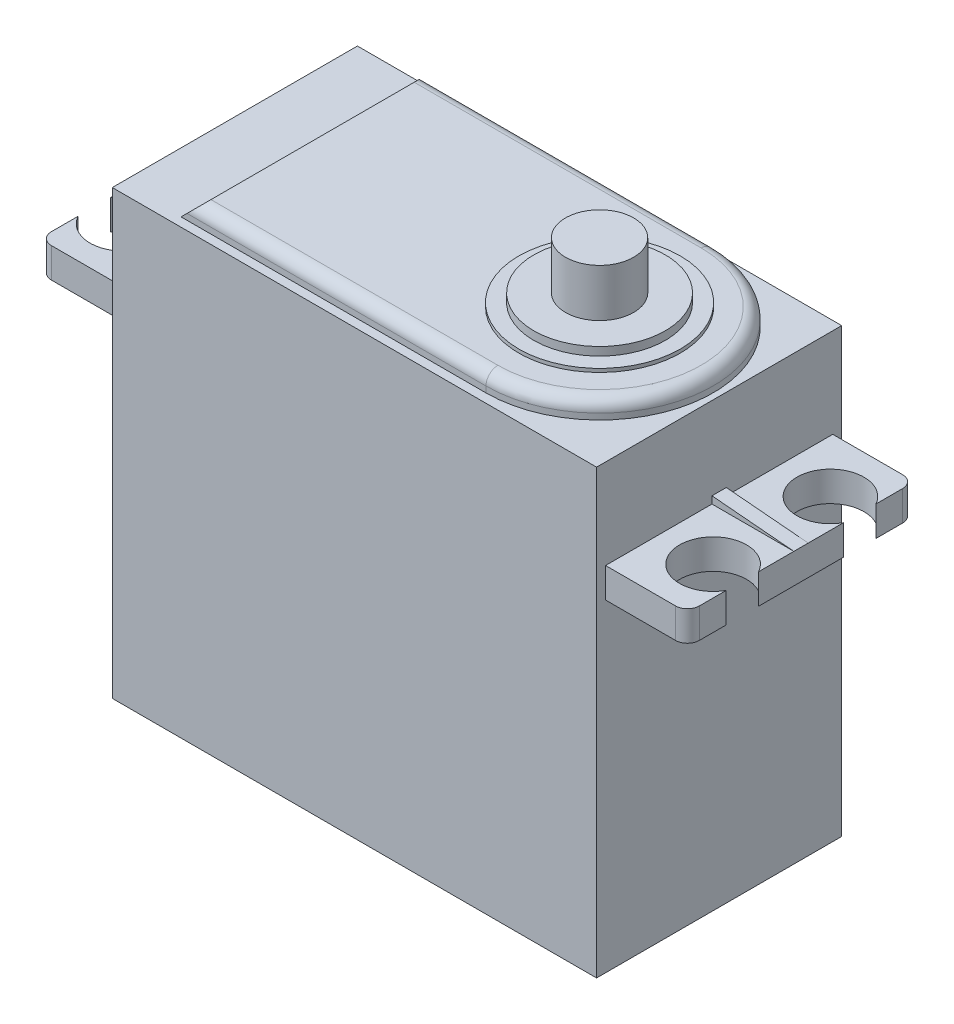
from build123d import *

# Parameters (mm, degrees)
CROQUIS1_W              = 40.5
CROQUIS1_H              = 20.5
SALIENTE_EXTRUIR1_DEPTH = 38.5
SALIENTE_EXTRUIR2_START = -11.5
SALIENTE_EXTRUIR2_DEPTH = 2.5
SALIENTE_EXTRUIR6_DEPTH = 0.6
SIMETR_A2_START         = -11.5
SIMETR_A2_COPY_1_DEPTH  = 2.5
CROQUIS4_W              = 40.5
CROQUIS4_H              = 20.5
CORTAR_EXTRUIR3_DEPTH   = 1.5
CHAFL_N1_SIZE           = 1.5
REDONDEO1_R             = 1
CROQUIS5_R              = 6.75
SALIENTE_EXTRUIR3_DEPTH = 0.3
CROQUIS6_R              = 5.5
SALIENTE_EXTRUIR4_DEPTH = 0.7
CROQUIS7_R              = 2.85
SALIENTE_EXTRUIR5_DEPTH = 4


with BuildPart() as part:
    # Croquis1 → Saliente-Extruir1 (new body)
    with BuildSketch(Plane(origin=(0, 0, 0), x_dir=(1, 0, 0), z_dir=(0, 1, 0))):
        Rectangle(CROQUIS1_W, CROQUIS1_H)
    extrude(amount=SALIENTE_EXTRUIR1_DEPTH)

    # Croquis2 → Saliente-Extruir2 (add)
    with BuildSketch(Plane(origin=(0, 38.5, 0), x_dir=(1, 0, 0), z_dir=(0, 1, 0)).offset(SALIENTE_EXTRUIR2_START)):
        with BuildLine():
            Line((-20.25, 9.5), (-26.1, 9.5))
            ThreePointArc((-26.1, 9.5), (-26.807106781, 9.207106781), (-27.1, 8.5))
            Line((-27.1, 8.5), (-27.1, 6.261088342))
            ThreePointArc((-27.1, 6.261088342), (-21.85, 4.905544171), (-27.1, 3.55))
            Line((-27.1, 3.55), (-27.1, 0))
            Line((-27.1, 0), (-20.25, 0))
            Line((-20.25, 0), (-20.25, 9.5))
        make_face()
    saliente_extruir2 = extrude(amount=SALIENTE_EXTRUIR2_DEPTH)

    # Simetría1: Saliente-Extruir2 across plane
    add(saliente_extruir2.mirror(Plane(origin=(0, 0, 0), x_dir=(1, 0, 0), z_dir=(0, 0, -1))))

    # Croquis8 → Saliente-Extruir6 (add, symmetric)
    with BuildSketch(Plane.XY):
        Polygon((-27.1, 29.5), (-20.25, 30.099297345), (-20.25, 29.5), align=None)
    saliente_extruir6 = extrude(amount=SALIENTE_EXTRUIR6_DEPTH, both=True)

    # Simetría2: Saliente-Extruir2, Saliente-Extruir6 across plane
    add(saliente_extruir2.mirror(Plane(origin=(0, 0, 0), x_dir=(0, 0, 1), z_dir=(1, 0, 0))))
    add(saliente_extruir6.mirror(Plane(origin=(0, 0, 0), x_dir=(0, 0, 1), z_dir=(1, 0, 0))))

    # Simetría2 copy 1 sketch → Simetría2 copy 1 (add)
    with BuildSketch(Plane(origin=(0, 38.5, 0), x_dir=(-1, 0, 0), z_dir=(0, 1, 0)).offset(SIMETR_A2_START)):
        with BuildLine():
            Line((-20.25, 9.5), (-26.1, 9.5))
            ThreePointArc((-26.1, 9.5), (-26.807106781, 9.207106781), (-27.1, 8.5))
            Line((-27.1, 8.5), (-27.1, 6.261088342))
            ThreePointArc((-27.1, 6.261088342), (-21.85, 4.905544171), (-27.1, 3.55))
            Line((-27.1, 3.55), (-27.1, 0))
            Line((-27.1, 0), (-20.25, 0))
            Line((-20.25, 0), (-20.25, 9.5))
        make_face()
    extrude(amount=SIMETR_A2_COPY_1_DEPTH)

    # Croquis4 → Cortar-Extruir3 (cut)
    with BuildSketch(Plane(origin=(0, 38.5, 0), x_dir=(1, 0, 0), z_dir=(0, 1, 0))):
        Rectangle(CROQUIS4_W, CROQUIS4_H)
        with BuildLine():
            Line((-15.25, 9.5), (-15.25, -9.5))
            Line((-15.25, -9.5), (10.25, -9.5))
            ThreePointArc((10.25, -9.5), (19.75, 0), (10.25, 9.5))
            Line((10.25, 9.5), (-15.25, 9.5))
        make_face(mode=Mode.SUBTRACT)
    extrude(amount=-CORTAR_EXTRUIR3_DEPTH, mode=Mode.SUBTRACT)

    # Chaflán1
    chafl_n1_edges = [part.edges().sort_by_distance(p)[0] for p in [
        (-15.25, 38.5, 0),
    ]]
    chamfer(chafl_n1_edges, length=CHAFL_N1_SIZE - 0.0001)  # a hair under: the kernel refuses the full size

    # Redondeo1
    redondeo1_edges = [part.edges().sort_by_distance(p)[0] for p in [
        (-1.75005, 38.5, -9.5),
        (19.75, 38.5, 0),
        (-1.75005, 38.5, 9.5),
    ]]
    fillet(redondeo1_edges, radius=REDONDEO1_R)

    # Croquis5 → Saliente-Extruir3 (add)
    with BuildSketch(Plane(origin=(0, 38.5, 0), x_dir=(1, 0, 0), z_dir=(0, 1, 0))):
        with Locations(Location((10.25, 0, 0), (0, 0, 90))):
            Circle(CROQUIS5_R)
    extrude(amount=SALIENTE_EXTRUIR3_DEPTH)

    # Croquis6 → Saliente-Extruir4 (add)
    with BuildSketch(Plane(origin=(0, 38.8, 0), x_dir=(1, 0, 0), z_dir=(0, 1, 0))):
        with Locations(Location((10.25, 0, 0), (0, 0, 270))):
            Circle(CROQUIS6_R)
    extrude(amount=SALIENTE_EXTRUIR4_DEPTH)

    # Croquis7 → Saliente-Extruir5 (add)
    with BuildSketch(Plane(origin=(0, 39.5, 0), x_dir=(1, 0, 0), z_dir=(0, 1, 0))):
        with Locations(Location((10.25, 0, 0), (0, 0, 270))):
            Circle(CROQUIS7_R)
    extrude(amount=SALIENTE_EXTRUIR5_DEPTH)


solid = part.part
